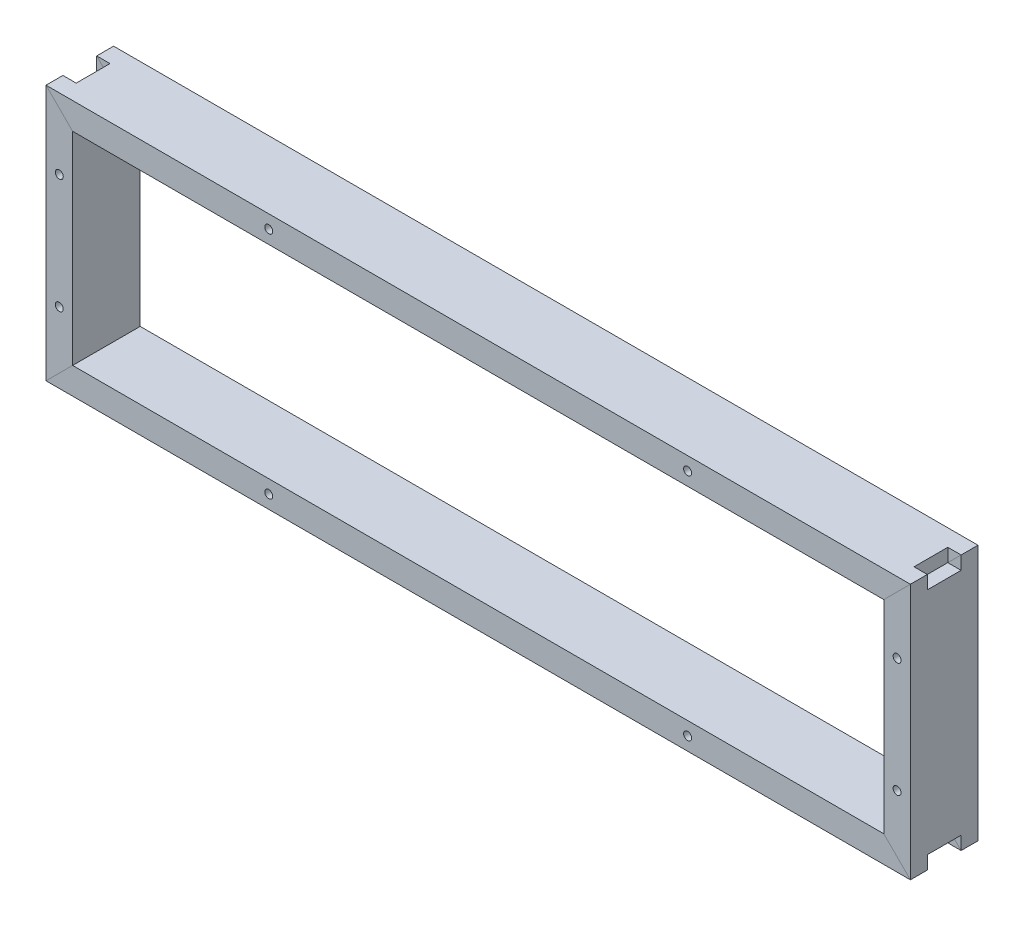
from build123d import *

# Parameters (mm, degrees)
SKETCH1_W               = 324.8012934
SKETCH1_H               = 96.2008736
SKETCH1_W_2             = 304.8012934
SKETCH1_H_2             = 76.2008736
BOSS_EXTRUDE1_DEPTH     = 25.4
SKETCH2_R               = 1.5
CUT_EXTRUDE1_DEPTH      = 25.4
SPLIT1_START            = -1
SPLIT1_OUTLINE_W        = 231.654651096
SPLIT1_OUTLINE_H        = 25.4
SPLIT1_DEPTH            = 300
SPLIT1_START_2          = 122.296599373
SPLIT1_2_OUTLINE_W      = 69.345348904
SPLIT1_2_OUTLINE_H      = 25.4
SPLIT1_2_DEPTH          = 107.4953748
SPLIT1_START_3          = -25.4
SPLIT1_3_OUTLINE_R      = 1.5
SPLIT1_3_DEPTH          = 25.4
SPLIT1_4_OUTLINE_R      = 1.5
SPLIT1_4_DEPTH          = 25.4
SPLIT1_5_DEPTH          = 25.4
SPLIT1_6_OUTLINE_R      = 1.5
SPLIT1_6_DEPTH          = 25.4
SPLIT1_7_OUTLINE_R      = 1.5
SPLIT1_7_DEPTH          = 25.4
SPLIT1_8_DEPTH          = 25.4
SPLIT1_9_OUTLINE_R      = 1.5
SPLIT1_9_DEPTH          = 25.4
CUT_EXTRUDE2_DEPTH      = 6.35
CUT_EXTRUDE2_DEPTH_BACK = 6.35
SKETCH5_W               = 5
SKETCH5_H               = 5


with BuildPart() as part:
    # Sketch1 → Boss-Extrude1 (new body)
    with BuildSketch(Plane.XY):
        with Locations((162.4943533, 48.1803632)):
            Rectangle(SKETCH1_W, SKETCH1_H)
        with Locations((162.4943533, 48.1803632)):
            Rectangle(SKETCH1_W_2, SKETCH1_H_2, mode=Mode.SUBTRACT)
    extrude(amount=-BOSS_EXTRUDE1_DEPTH)

    # Sketch2 → Cut-Extrude1 (cut)
    with BuildSketch(Plane.XY):
        with Locations((83.79402995, 91.2808)):
            Circle(SKETCH2_R)
        with Locations((241.182963325, 91.2808)):
            Circle(SKETCH2_R)
        with Locations((319.895, 69.710908993)):
            Circle(SKETCH2_R)
        with Locations((319.895, 26.629837247)):
            Circle(SKETCH2_R)
        with Locations((241.182963325, 5.0699356)):
            Circle(SKETCH2_R)
        with Locations((83.79402995, 5.0599448)):
            Circle(SKETCH2_R)
        with Locations((5.07026943, 26.629837247)):
            Circle(SKETCH2_R)
        with Locations((5.081988015, 69.710908993)):
            Circle(SKETCH2_R)
    extrude(amount=-CUT_EXTRUDE1_DEPTH, mode=Mode.SUBTRACT)

    # Split1: read off the stored shape, not the designer's step
    # Split1 outline → Split1 (cut)
    with BuildSketch(Plane(origin=(0, 0, 0), x_dir=(0.707106781186548, -0.707106781186547, 0), z_dir=(0.707106781186547, 0.707106781186548, 0)).offset(SPLIT1_START)):
        with Locations((45.827325548, 12.7)):
            Rectangle(SPLIT1_OUTLINE_W, SPLIT1_OUTLINE_H)
    extrude(amount=SPLIT1_DEPTH, mode=Mode.SUBTRACT)

    # Split1 2 outline → Split1 2 (cut)
    with BuildSketch(Plane(origin=(0, 0, 0), x_dir=(0.707106781186548, -0.707106781186547, 0), z_dir=(0.707106781186547, 0.707106781186548, 0)).offset(SPLIT1_START_2)):
        with Locations((196.327325548, 12.7)):
            Rectangle(SPLIT1_2_OUTLINE_W, SPLIT1_2_OUTLINE_H)
    extrude(amount=SPLIT1_2_DEPTH, mode=Mode.SUBTRACT)


with BuildPart() as body_2:
    # Split1 3 outline → Split1 3 (new body)
    with BuildSketch(Plane.XY.offset(SPLIT1_START_3)):
        Polygon((0.0937066, 0.0799264), (10.0937066, 10.0799264), (10.0937066, 86.2808), (0.0937066, 96.2808), align=None)
        with Locations((5.07026943, 26.629837247)):
            Circle(SPLIT1_3_OUTLINE_R, mode=Mode.SUBTRACT)
        with Locations((5.081988015, 69.710908993)):
            Circle(SPLIT1_3_OUTLINE_R, mode=Mode.SUBTRACT)
    extrude(amount=SPLIT1_3_DEPTH)


with BuildPart() as body_3:
    # Split1 4 outline → Split1 4 (new body)
    with BuildSketch(Plane.XY.offset(SPLIT1_START_3)):
        Polygon((324.895, 0.0799264), (314.895, 10.0799264), (238.6941264, 10.0799264), (228.6941264, 0.0799264), align=None)
        with Locations((241.182963325, 5.0699356)):
            Circle(SPLIT1_4_OUTLINE_R, mode=Mode.SUBTRACT)
    extrude(amount=SPLIT1_4_DEPTH)


with BuildPart() as body_4:
    # Split1 5 outline → Split1 5 (new body)
    with BuildSketch(Plane.XY.offset(SPLIT1_START_3)):
        Polygon((228.6941264, 0.0799264), (238.6941264, 10.0799264), (86.2945802, 10.0799264), (96.2945802, 0.0799264), align=None)
    extrude(amount=SPLIT1_5_DEPTH)


with BuildPart() as body_5:
    # Split1 6 outline → Split1 6 (new body)
    with BuildSketch(Plane.XY.offset(SPLIT1_START_3)):
        Polygon((96.2945802, 0.0799264), (86.2945802, 10.0799264), (10.0937066, 10.0799264), (0.0937066, 0.0799264), align=None)
        with Locations((83.79402995, 5.0599448)):
            Circle(SPLIT1_6_OUTLINE_R, mode=Mode.SUBTRACT)
    extrude(amount=SPLIT1_6_DEPTH)


with BuildPart() as body_6:
    # Split1 7 outline → Split1 7 (new body)
    with BuildSketch(Plane.XY.offset(SPLIT1_START_3)):
        Polygon((314.895, 86.2808), (324.895, 96.2808), (228.6941264, 96.2808), (238.6941264, 86.2808), align=None)
        with Locations((241.182963325, 91.2808)):
            Circle(SPLIT1_7_OUTLINE_R, mode=Mode.SUBTRACT)
    extrude(amount=SPLIT1_7_DEPTH)


with BuildPart() as body_7:
    # Split1 8 outline → Split1 8 (new body)
    with BuildSketch(Plane.XY.offset(SPLIT1_START_3)):
        Polygon((238.6941264, 86.2808), (228.6941264, 96.2808), (96.2945802, 96.2808), (86.2945802, 86.2808), align=None)
    extrude(amount=SPLIT1_8_DEPTH)


with BuildPart() as body_8:
    # Split1 9 outline → Split1 9 (new body)
    with BuildSketch(Plane.XY.offset(SPLIT1_START_3)):
        Polygon((86.2945802, 86.2808), (96.2945802, 96.2808), (0.0937066, 96.2808), (10.0937066, 86.2808), align=None)
        with Locations((83.79402995, 91.2808)):
            Circle(SPLIT1_9_OUTLINE_R, mode=Mode.SUBTRACT)
    extrude(amount=SPLIT1_9_DEPTH)

    # Combine1: union body 7, body 6
    add(body_7.part)
    add(body_6.part)


with BuildPart() as body_4_1:
    add(body_4.part)

    # Combine2: read off the stored shape, not the designer's step
    # Combine2: union body 3, body 5
    add(body_3.part)
    add(body_5.part)


with BuildPart() as cut_extrude2_tool:
    # Sketch5 → Cut-Extrude2 (new, two sides: drawn at the far end of the back side and taken through both)
    with BuildSketch(Plane.YX.offset(12.7).offset(-CUT_EXTRUDE2_DEPTH_BACK)):
        with Locations((2.5799264, 322.395)):
            Rectangle(SKETCH5_W, SKETCH5_H)
        with Locations((2.5799264, 2.5937066)):
            Rectangle(SKETCH5_W, SKETCH5_H)
        with Locations((93.7808, 2.5937066)):
            Rectangle(SKETCH5_W, SKETCH5_H)
        with Locations((93.7808, 322.395)):
            Rectangle(SKETCH5_W, SKETCH5_H)
    extrude(amount=CUT_EXTRUDE2_DEPTH + CUT_EXTRUDE2_DEPTH_BACK)


with BuildPart() as part_1:
    add(part.part)

    # Cut-Extrude2: cut by cut_extrude2_tool
    add(cut_extrude2_tool.part, mode=Mode.SUBTRACT)


with BuildPart() as body_2_1:
    add(body_2.part)

    # Cut-Extrude2: cut by cut_extrude2_tool
    add(cut_extrude2_tool.part, mode=Mode.SUBTRACT)


with BuildPart() as body_4_2:
    add(body_4_1.part)

    # Cut-Extrude2: cut by cut_extrude2_tool
    add(cut_extrude2_tool.part, mode=Mode.SUBTRACT)


with BuildPart() as body_8_1:
    add(body_8.part)

    # Cut-Extrude2: cut by cut_extrude2_tool
    add(cut_extrude2_tool.part, mode=Mode.SUBTRACT)


solid = Compound([part_1.part, body_2_1.part, body_4_2.part, body_8_1.part])
